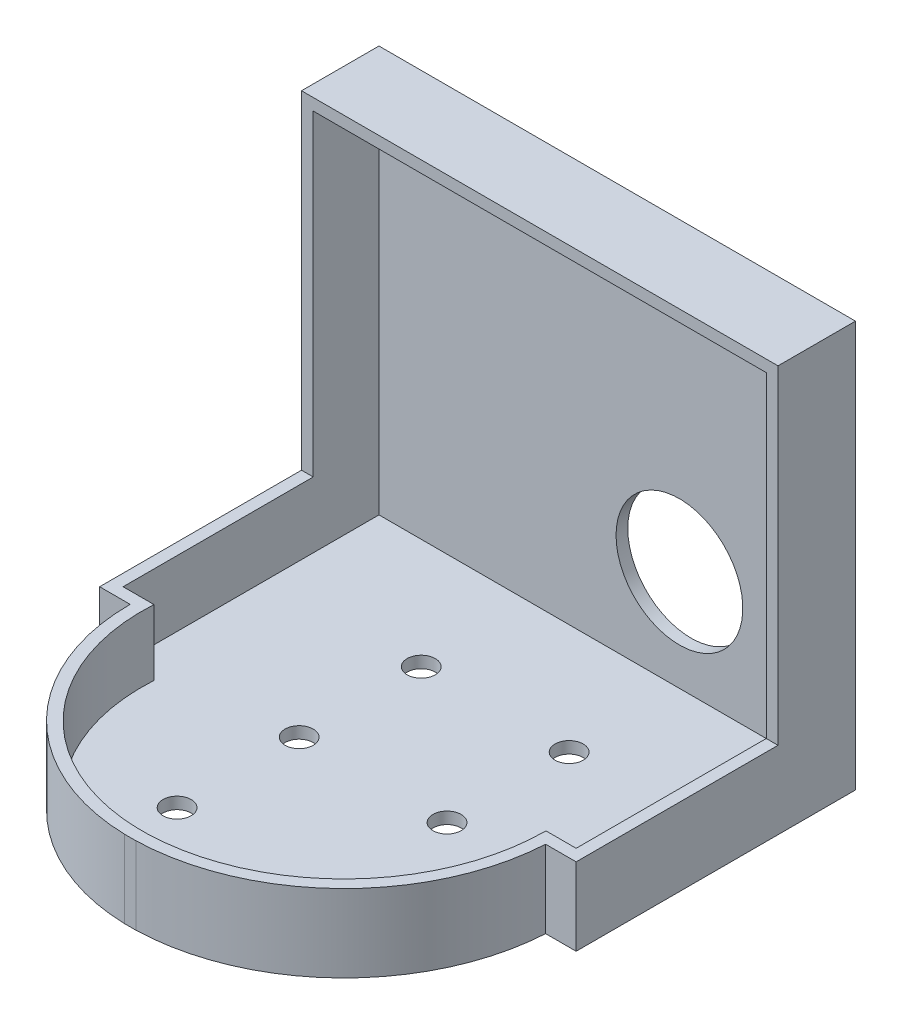
from build123d import *

# Parameters (mm, degrees)
CROQUIS1_W              = 203
CROQUIS1_H              = 205
SALIENTE_EXTRUIR1_DEPTH = 173
CROQUIS2_W              = 172
CROQUIS2_H              = 140
CORTAR_EXTRUIR1_DEPTH   = 211
CORTAR_EXTRUIR2_DEPTH   = 33
VACIADO1_START          = 5
VACIADO1_DEPTH          = 163
CROQUIS6_R              = 27
CORTAR_EXTRUIR4_DEPTH   = 5
CROQUIS8_R              = 6
CORTAR_EXTRUIR5_DEPTH   = 5


# Read off the part's stored shape, not the designer's step: Vaciado1
with BuildPart() as part:
    # Croquis1 → Saliente-Extruir1 (new body)
    with BuildSketch(Plane(origin=(0, 0, 0), x_dir=(1, 0, 0), z_dir=(0, 1, 0))):
        with Locations((0, 19.601485149)):
            Rectangle(CROQUIS1_W, CROQUIS1_H)
    extrude(amount=SALIENTE_EXTRUIR1_DEPTH)

    # Croquis2 → Cortar-Extruir1 (cut)
    with BuildSketch(Plane.ZY.offset(101.5)):
        with Locations((-3.101485149, 103)):
            Rectangle(CROQUIS2_W, CROQUIS2_H)
    extrude(amount=-CORTAR_EXTRUIR1_DEPTH, mode=Mode.SUBTRACT)

    # Croquis3 → Cortar-Extruir2 (cut)
    with BuildSketch(Plane(origin=(0, 33, 0), x_dir=(1, 0, 0), z_dir=(0, 1, 0))):
        with BuildLine():
            Line((-101.5, 3.101485149), (-101.5, -82.898514851))
            Line((-101.5, -82.898514851), (-88.5, -82.898514851))
            Line((-88.5, -82.898514851), (-4.929378531, -82.898514851))
            ThreePointArc((-4.929378531, -82.898514851), (-64.166087143, -56.856935388), (-88.5, 3.101485149))
            Line((-88.5, 3.101485149), (-101.5, 3.101485149))
        make_face()
        with BuildLine():
            ThreePointArc((88.5, 3.101485149), (60.988030108, -57.123115602), (0, -82.898514851))
            Line((0, -82.898514851), (88.5, -82.898514851))
            Line((88.5, -82.898514851), (101.5, -82.898514851))
            Line((101.5, -82.898514851), (101.5, 3.101485149))
            Line((101.5, 3.101485149), (88.5, 3.101485149))
        make_face()
    extrude(amount=-CORTAR_EXTRUIR2_DEPTH, mode=Mode.SUBTRACT)

    # Vaciado1 outline → Vaciado1 (cut)
    with BuildSketch(Plane(origin=(0, 0, 0), x_dir=(1, 0, 0), z_dir=(0, 1, 0)).offset(VACIADO1_START)):
        with BuildLine():
            Line((-96.5, 8.101485149), (-83.345599163, 8.101485149))
            ThreePointArc((-83.345599163, 8.101485149), (-62.319461008, -51.525686528), (-4.856672926, -77.898514851))
            Line((-4.856672926, -77.898514851), (-0.072642407, -77.898514851))
            ThreePointArc((-0.072642407, -77.898514851), (59.19666813, -51.84566757), (83.649498309, 8.101485149))
            Line((83.649498309, 8.101485149), (96.5, 8.101485149))
            Line((96.5, 8.101485149), (96.5, 117.101485149))
            Line((96.5, 117.101485149), (-96.5, 117.101485149))
            Line((-96.5, 117.101485149), (-96.5, 8.101485149))
        make_face()
    extrude(amount=VACIADO1_DEPTH, mode=Mode.SUBTRACT)

    # Croquis6 → Cortar-Extruir4 (cut)
    with BuildSketch(Plane(origin=(0, 0, -122.101485149), x_dir=(-1, 0, 0), z_dir=(0, 0, -1))):
        with Locations((-31.5, 48)):
            Circle(CROQUIS6_R)
    extrude(amount=-CORTAR_EXTRUIR4_DEPTH, mode=Mode.SUBTRACT)

    # Croquis8 → Cortar-Extruir5 (cut)
    with BuildSketch(Plane.XZ):
        with Locations(Location((-31.5, -70.101485149, 0), (0, 0, 270))):
            Circle(CROQUIS8_R)
        with Locations(Location((-31.5, -18.101485149, 0), (0, 0, 270))):
            Circle(CROQUIS8_R)
        with Locations(Location((-31.5, 33.898514851, 0), (0, 0, 270))):
            Circle(CROQUIS8_R)
        with Locations(Location((31.5, -18.101485149, 0), (0, 0, 270))):
            Circle(CROQUIS8_R)
        with Locations(Location((31.5, 33.898514851, 0), (0, 0, 270))):
            Circle(CROQUIS8_R)
        with Locations(Location((31.5, -70.101485149, 0), (0, 0, 270))):
            Circle(CROQUIS8_R)
    extrude(amount=-CORTAR_EXTRUIR5_DEPTH, mode=Mode.SUBTRACT)


solid = part.part
